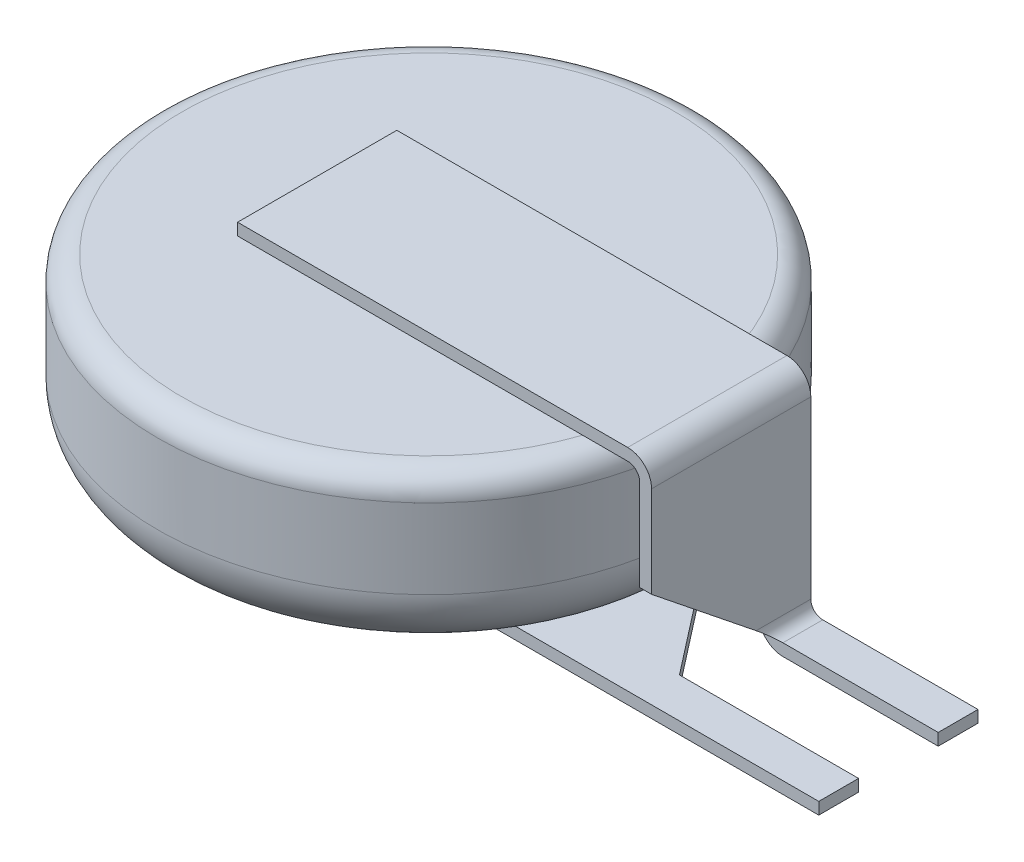
from build123d import *

# Parameters (mm, degrees)
FILLET_1_R          = 0.3
FILLET_2_R          = 0.8
FILLET_3_R          = 0.2
EXTRUDE_1_DEPTH     = 1
CUT_EXTRUDE_1_DEPTH = 2.25
CUT_EXTRUDE_2_DEPTH = 0.15
FILLET_5_R          = 0.15
FILLET_4_R          = 0.3


with BuildPart() as part:
    # 草图1 → 旋转1 (revolve)
    with BuildSketch(Plane.XY, mode=Mode.PRIVATE) as revolve_1_sk:
        Polygon((0, 2.65), (3.4, 2.65), (3.4, 0.551967957), (2.6, 0.551967957), (2.505416246, 0.412581372), (2.370117547, 0.412581372), (2.19193733, 0.15), (0, 0.15), align=None)
    revolve(revolve_1_sk.sketch.rotate(Axis((0, 2.65, 0), (0, -1, 0)), 180), axis=Axis((0, 2.65, 0), (0, -1, 0)))

    # 圆角1
    fillet_1_edges = [part.edges().sort_by_distance(p)[0] for p in [
        (3.4, 2.65, 0),
    ]]
    fillet(fillet_1_edges, radius=FILLET_1_R)

    # 圆角2
    fillet_2_edges = [part.edges().sort_by_distance(p)[0] for p in [
        (3.4, 0.551967957, 0),
    ]]
    fillet(fillet_2_edges, radius=FILLET_2_R - 0.0001)  # a hair under: the kernel refuses the full size

    # 圆角3
    fillet_3_edges = [part.edges().sort_by_distance(p)[0] for p in [
        (2.19193733, 0.15, 0),
    ]]
    fillet(fillet_3_edges, radius=FILLET_3_R)

    # 草图3 → 凸台-拉伸1 (add, symmetric)
    with BuildSketch(Plane.XY):
        Polygon((-1.798436821, 0.15), (3.65, 0.15), (3.65, 2.65), (-1.4, 2.65), (-1.4, 2.8), (3.8, 2.8), (3.8, 0.15), (5.9, 0.15), (5.9, 0), (-1.798436821, 0), align=None)
    extrude(amount=EXTRUDE_1_DEPTH, both=True)

    # 草图4 → 切除-拉伸1 (cut)
    with BuildSketch(Plane(origin=(5.9, 0, 0), x_dir=(0, 0, -1), z_dir=(1, 0, 0))):
        Polygon((-1, 1.351967957), (0.5, 0.15), (0.5, 0), (-0.5, 0), (-0.5, 0.15), (-1, 0.15), align=None)
    extrude(amount=-CUT_EXTRUDE_1_DEPTH, mode=Mode.SUBTRACT)

    # 草图5 → 切除-拉伸2 (cut)
    with BuildSketch(Plane.XZ):
        Polygon((3.65, 0.5), (2.484512448, -1), (3.65, -1), align=None)
    extrude(amount=-CUT_EXTRUDE_2_DEPTH, mode=Mode.SUBTRACT)

    # 圆角5
    fillet_5_edges = [part.edges().sort_by_distance(p)[0] for p in [
        (3.65, 2.65, 0),
        (3.8, 0.15, -0.75),
    ]]
    fillet(fillet_5_edges, radius=FILLET_5_R)

    # 圆角4
    fillet_4_edges = [part.edges().sort_by_distance(p)[0] for p in [
        (3.65, 0, -0.75),
        (3.8, 2.8, 0),
    ]]
    fillet(fillet_4_edges, radius=FILLET_4_R)


solid = part.part
